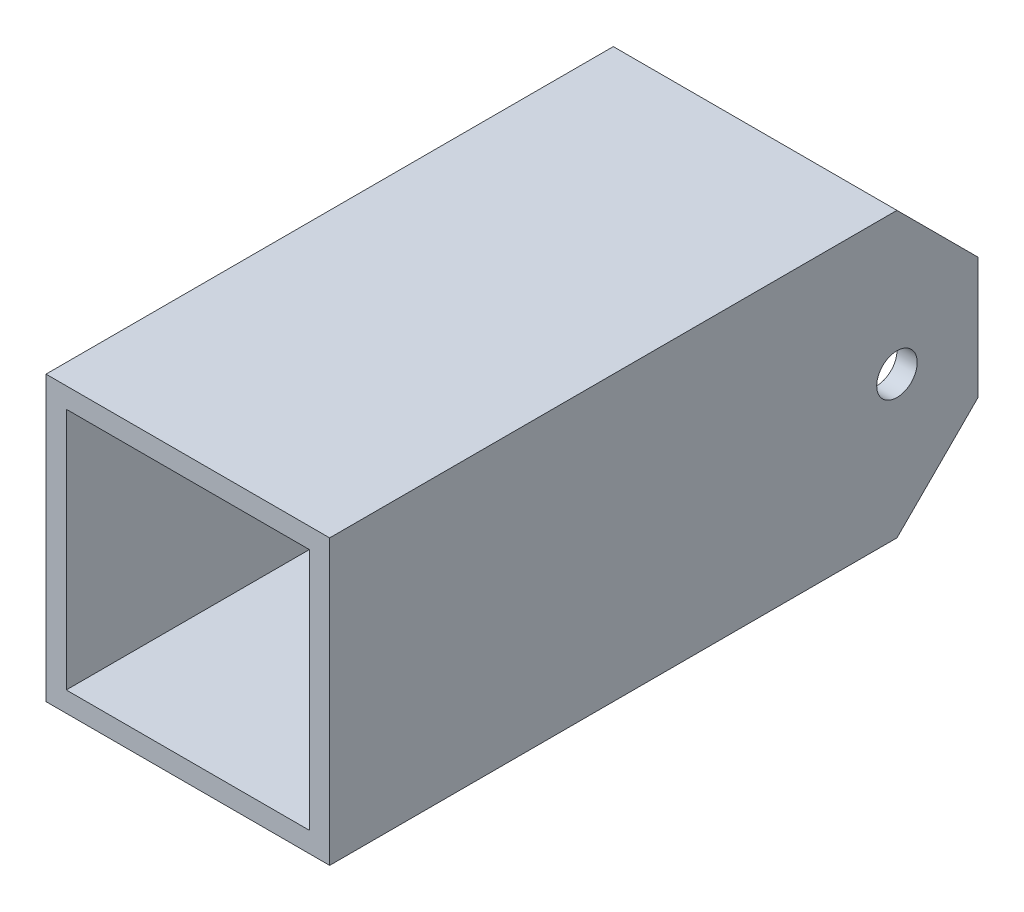
from build123d import *

# Parameters (mm, degrees)
SKETCH2_W           = 44.45
SKETCH2_H           = 44.45
SKETCH2_W_2         = 38.1
SKETCH2_H_2         = 38.1
BOSS_EXTRUDE1_DEPTH = 101.6
SKETCH5_R           = 3.175
CUT_EXTRUDE1_DEPTH  = 54.864
CHAMFER1_SIZE       = 12.7


with BuildPart() as part:
    # Sketch2 → Boss-Extrude1 (new body)
    with BuildSketch(Plane.XY):
        Rectangle(SKETCH2_W, SKETCH2_H)
        Rectangle(SKETCH2_W_2, SKETCH2_H_2, mode=Mode.SUBTRACT)
    extrude(amount=BOSS_EXTRUDE1_DEPTH)

    # Sketch5 → Cut-Extrude1 (cut)
    with BuildSketch(Plane.ZY.offset(22.225)):
        with Locations(Location((12.7, 0, 0), (0, 0, 270))):
            Circle(SKETCH5_R)
    extrude(amount=-CUT_EXTRUDE1_DEPTH, mode=Mode.SUBTRACT)

    # Chamfer1
    # the kernel refuses this chamfer: 12.7 mm, written as the material it takes off along each edge
    with BuildSketch(Plane(origin=(54.885373947, -22.225, 0), x_dir=(0, 0.9996219169112966, -0.02749587661058637), z_dir=(-1, 0, 0))) as chamfer1_piece_1:
        Polygon((CHAMFER1_SIZE * 0.999621916911, -CHAMFER1_SIZE * 0.0274958766106), (-CHAMFER1_SIZE * 0.0274958766106, -CHAMFER1_SIZE * 0.999621916911), (0, 0), align=None)
    extrude(amount=109.770747894, mode=Mode.SUBTRACT)
    with BuildSketch(Plane(origin=(-54.885373947, 22.225, 0), x_dir=(0, 0.02749587661058647, 0.9996219169112966), z_dir=(1, 0, 0))) as chamfer1_piece_2:
        Polygon((CHAMFER1_SIZE * 0.999621916911, CHAMFER1_SIZE * 0.0274958766106), (-CHAMFER1_SIZE * 0.0274958766106, CHAMFER1_SIZE * 0.999621916911), (0, 0), align=None)
    extrude(amount=109.770747894, mode=Mode.SUBTRACT)


solid = part.part
